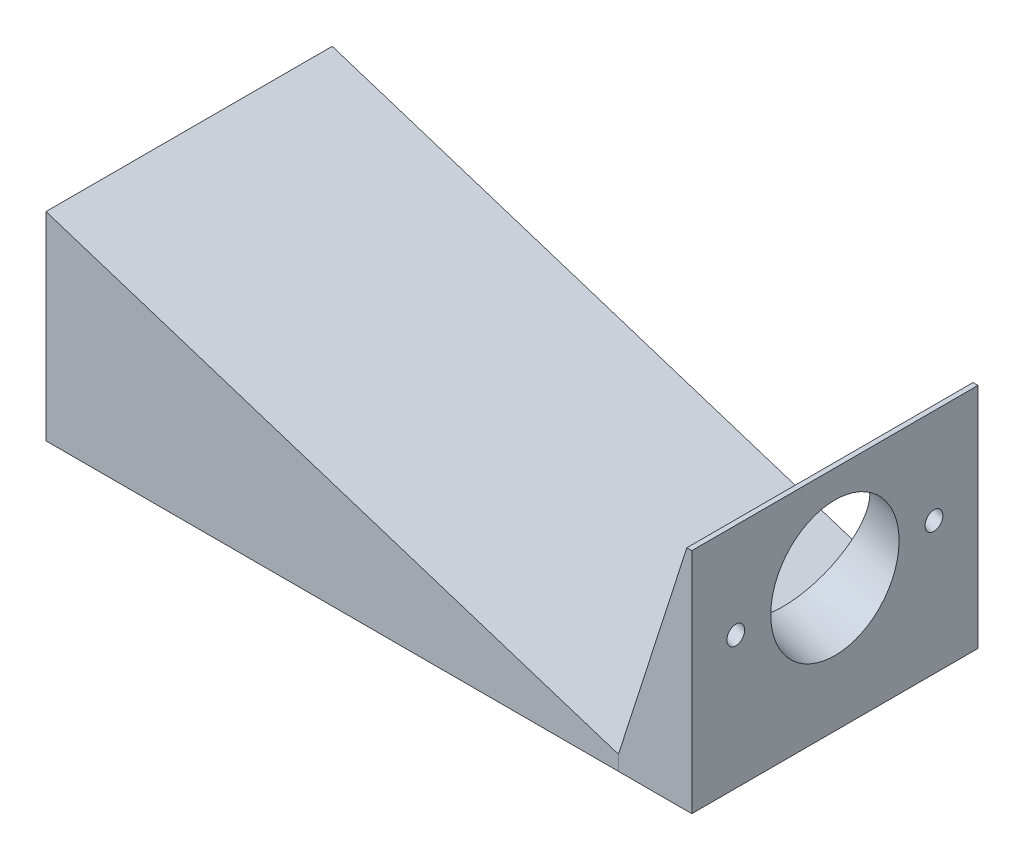
from build123d import *

# Parameters (mm, degrees)
SALIENTE_EXTRUIR1_DEPTH = 29
SALIENTE_EXTRUIR2_DEPTH = 29
CROQUIS6_R              = 6.5
CORTAR_EXTRUIR1_DEPTH   = 70.533401912
CROQUIS9_R              = 6.5
CROQUIS9_R_2            = 0.9
CORTAR_EXTRUIR2_DEPTH   = 70.533401912
CROQUIS10_R             = 1.5
CORTAR_EXTRUIR3_DEPTH   = 4


with BuildPart() as part:
    # Croquis1 → Saliente-Extruir1 (new body)
    with BuildSketch(Plane.XY):
        Polygon((-29, 0), (29, 0), (29, 1.5), (-29, 20.12176278), align=None)
    extrude(amount=-SALIENTE_EXTRUIR1_DEPTH)


with BuildPart() as body_2:
    # Croquis3 → Saliente-Extruir2 (new body)
    with BuildSketch(Plane.XY):
        Polygon((29, 0), (29, 1.5), (35.929906485, 23.084131474), (36.429906485, 23.084131474), (36.429906485, 0), align=None)
    extrude(amount=-SALIENTE_EXTRUIR2_DEPTH)

    # Croquis6 → Cortar-Extruir1 (cut, through all)
    with BuildSketch(Plane(origin=(25.853368808, -8.300608638, 0), x_dir=(0, 0, 1), z_dir=(-0.9521293927421397, 0.30569530496310254, 0))):
        with Locations((-14.5, 23.943357933)):
            Circle(CROQUIS6_R)
    extrude(amount=-CORTAR_EXTRUIR1_DEPTH, mode=Mode.SUBTRACT)

    # Croquis9 → Cortar-Extruir2 (cut, through all)
    with BuildSketch(Plane(origin=(25.853368808, -8.300608638, 0), x_dir=(0, 0, 1), z_dir=(-0.9521293927421397, 0.30569530496310254, 0))):
        with Locations((-14.5, 23.943357933)):
            Circle(CROQUIS9_R)
        with Locations((-24.54, 23.943357933)):
            Circle(CROQUIS9_R_2)
        with Locations((-4.46, 23.943357933)):
            Circle(CROQUIS9_R_2)
    extrude(amount=-CORTAR_EXTRUIR2_DEPTH, mode=Mode.SUBTRACT)


with BuildPart() as cortar_extruir3_tool:
    # Croquis10 → Cortar-Extruir3 (new body)
    with BuildSketch(Plane.XZ):
        with Locations((-23.285046758, -6)):
            Circle(CROQUIS10_R)
        with Locations((-23.285046758, -23)):
            Circle(CROQUIS10_R)
        with Locations((32.714953242, -6)):
            Circle(CROQUIS10_R)
        with Locations((32.714953242, -23)):
            Circle(CROQUIS10_R)
        with Locations((4.714953242, -14.5)):
            Circle(CROQUIS10_R)
    extrude(amount=-CORTAR_EXTRUIR3_DEPTH)


with BuildPart() as part_1:
    add(part.part)

    # Cortar-Extruir3: cut by cortar_extruir3_tool
    add(cortar_extruir3_tool.part, mode=Mode.SUBTRACT)


with BuildPart() as body_2_1:
    add(body_2.part)

    # Cortar-Extruir3: cut by cortar_extruir3_tool
    add(cortar_extruir3_tool.part, mode=Mode.SUBTRACT)


solid = Compound([part_1.part, body_2_1.part])
